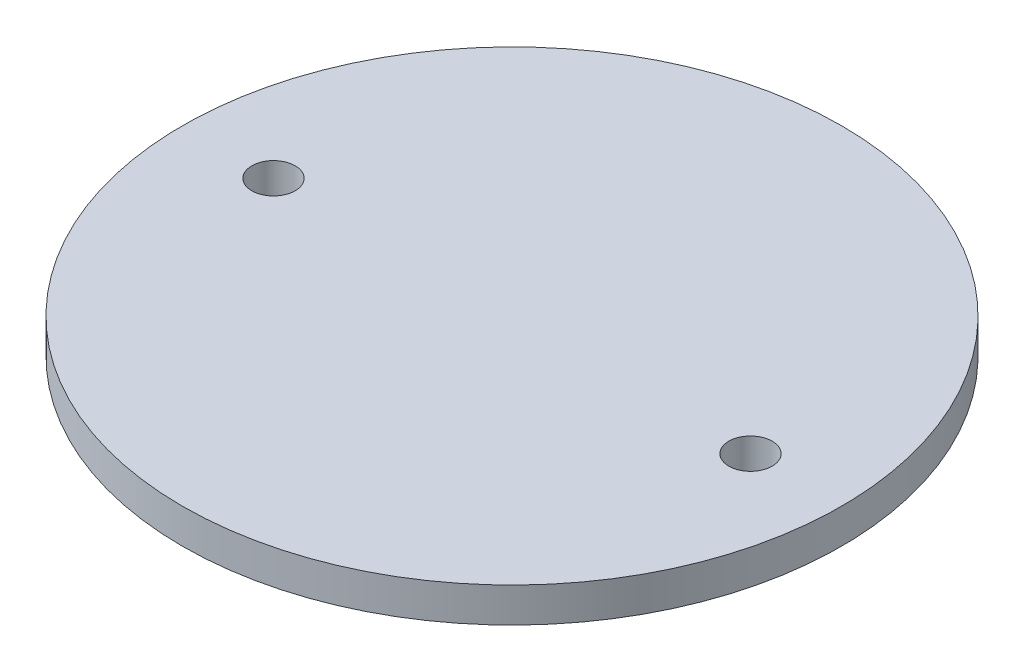
from build123d import *

# Parameters (mm, degrees)
SKETCH1_R           = 38
SKETCH1_R_2         = 2.5
BOSS_EXTRUDE1_DEPTH = 4


with BuildPart() as part:
    # Sketch1 → Boss-Extrude1 (new body)
    with BuildSketch(Plane(origin=(0, 0, 0), x_dir=(1, 0, 0), z_dir=(0, 1, 0))):
        Circle(SKETCH1_R)
        with Locations((-27.5, 0)):
            Circle(SKETCH1_R_2, mode=Mode.SUBTRACT)
        with Locations((27.5, 0)):
            Circle(SKETCH1_R_2, mode=Mode.SUBTRACT)
    extrude(amount=BOSS_EXTRUDE1_DEPTH)


solid = part.part
